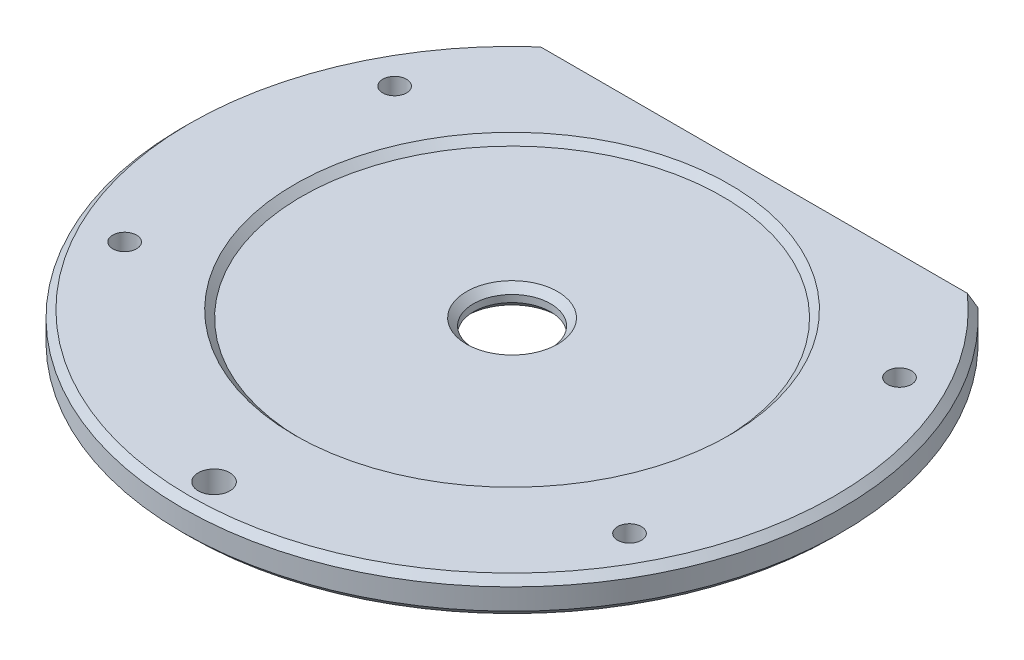
from build123d import *

# Parameters (mm, degrees)
SKETCH_2_R          = 94
EXTRUDE_1_DEPTH     = 5
SKETCH_3_W          = 204.518128244
SKETCH_3_H          = 25
CUT_EXTRUDE_1_DEPTH = 134.311664906
SKETCH_4_R          = 11
CUT_EXTRUDE_2_DEPTH = 134.311664906
SKETCH_5_R          = 60
CUT_EXTRUDE_3_DEPTH = 2
M8X1_25_1_D         = 6.8
M8X1_25_1_DEPTH     = 19.75
M8X1_25_1_TIP       = 2.042926105
SKETCH_8_R          = 4.5
CUT_EXTRUDE_4_DEPTH = 134.311664906
CHAMFER_1_SIZE      = 2


with BuildPart() as part:
    # 草图2 → 凸台-拉伸1 (new, symmetric)
    with BuildSketch(Plane(origin=(0, 0, 0), x_dir=(1, 0, 0), z_dir=(0, 1, 0))):
        with Locations(Location((0, 0, 0), (0, 0, 270))):
            Circle(SKETCH_2_R)
    extrude(amount=EXTRUDE_1_DEPTH, both=True)

    # 草图3 → 切除-拉伸1 (cut, through all)
    with BuildSketch(Plane(origin=(0, 5, 0), x_dir=(1, 0, 0), z_dir=(0, 1, 0))):
        with Locations((5.966826679, 81.5)):
            Rectangle(SKETCH_3_W, SKETCH_3_H)
    extrude(amount=-CUT_EXTRUDE_1_DEPTH, mode=Mode.SUBTRACT)

    # 草图4 → 切除-拉伸2 (cut, through all)
    with BuildSketch(Plane(origin=(0, 5, 0), x_dir=(1, 0, 0), z_dir=(0, 1, 0))):
        with Locations(Location((0, 0, 0), (0, 0, 270))):
            Circle(SKETCH_4_R)
    extrude(amount=-CUT_EXTRUDE_2_DEPTH, mode=Mode.SUBTRACT)

    # 草图5 → 切除-拉伸3 (cut)
    with BuildSketch(Plane(origin=(0, 5, 0), x_dir=(1, 0, 0), z_dir=(0, 1, 0))):
        with Locations(Location((0, 0, 0), (0, 0, 270))):
            Circle(SKETCH_5_R)
    cut_extrude_3 = extrude(amount=-CUT_EXTRUDE_3_DEPTH, mode=Mode.SUBTRACT)

    # 镜向1: 切除-拉伸3 across plane
    add(cut_extrude_3.mirror(Plane.ZX), mode=Mode.SUBTRACT)

    # M8x1.25 螺纹孔1
    with Locations(Plane(origin=(0, 5, 0), x_dir=(-1, 0, 0), z_dir=(0, 1, 0))):
        with Locations((72, -38.5), (-72, -38.5), (72, 38.5), (-72, 38.5)):
            Hole(M8X1_25_1_D / 2, depth=M8X1_25_1_DEPTH)
            with Locations((0, 0, -(M8X1_25_1_DEPTH + M8X1_25_1_TIP / 2))):  # 118° drill point
                Cone(0, M8X1_25_1_D / 2, M8X1_25_1_TIP, mode=Mode.SUBTRACT)

    # 草图8 → 切除-拉伸4 (cut, through all)
    with BuildSketch(Plane(origin=(0, 5, 0), x_dir=(1, 0, 0), z_dir=(0, 1, 0))):
        with Locations(Location((0, -85, 0), (0, 0, 270))):
            Circle(SKETCH_8_R)
    extrude(amount=-CUT_EXTRUDE_4_DEPTH, mode=Mode.SUBTRACT)

    # 倒角1
    chamfer_1_edges = [part.edges().sort_by_distance(p)[0] for p in [
        (0, 5, -60),
        (0, 3, -11),
        (0, -5, -60),
        (0, -3, -11),
        (0, -5, 94),
        (0, 5, 94),
    ]]
    chamfer(chamfer_1_edges, length=CHAMFER_1_SIZE - 0.0001)  # a hair under: the kernel refuses the full size


solid = part.part
